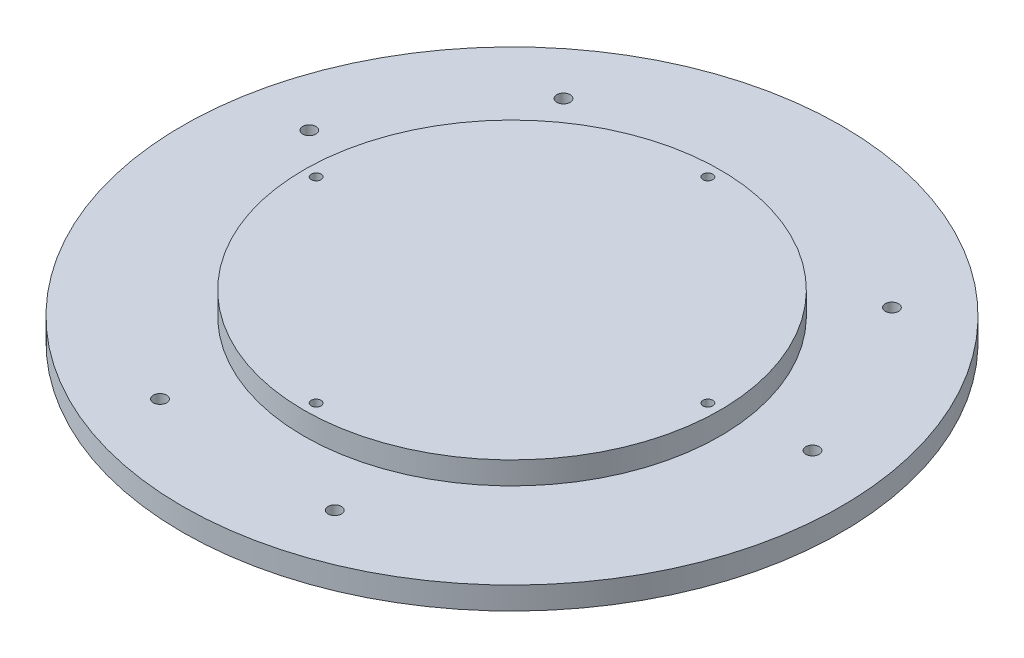
from build123d import *

# Parameters (mm, degrees)
ESQUISSE1_R                                = 84.1225
BOSS_EXTRU_1_DEPTH                         = 5.75
ESQUISSE2_R                                = 53.13
BOSS_EXTRU_2_DEPTH                         = 5.75
TROU_TARAUD_M31_D                          = 2.5
TROU_TARAUD_M31_DEPTH                      = 12.5
TROU_TARAUD_M31_TIP                        = 0.751075774
CHAMBRAGE_POUR_VIS_T_TE_HEXAGONALE_2_COUNT = 2
CHAMBRAGE_POUR_VIS_T_TE_HEXAGONALE_2_PITCH = 46.9428037
CHAMBRAGE_POUR_VIS_T_TE_HEXAGONALE_3_COUNT = 2
CHAMBRAGE_POUR_VIS_T_TE_HEXAGONALE_3_PITCH = 118.863351538
CHAMBRAGE_POUR_VIS_T_TE_HEXAGONALE_4_COUNT = 2
CHAMBRAGE_POUR_VIS_T_TE_HEXAGONALE_4_PITCH = 135.166416173
CHAMBRAGE_POUR_VIS_T_TE_HEXAGONALE_5_COUNT = 2
CHAMBRAGE_POUR_VIS_T_TE_HEXAGONALE_5_PITCH = 118.863351538
CHAMBRAGE_POUR_VIS_T_TE_HEXAGONALE_6_COUNT = 2
CHAMBRAGE_POUR_VIS_T_TE_HEXAGONALE_6_PITCH = 88.223612472


with BuildPart() as part:
    # Esquisse1 → Boss.-Extru.1 (new body)
    with BuildSketch(Plane(origin=(0, 0, 0), x_dir=(1, 0, 0), z_dir=(0, 1, 0))):
        Circle(ESQUISSE1_R)
    extrude(amount=-BOSS_EXTRU_1_DEPTH)

    # Esquisse2 → Boss.-Extru.2 (add)
    with BuildSketch(Plane(origin=(0, 0, 0), x_dir=(1, 0, 0), z_dir=(0, 1, 0))):
        Circle(ESQUISSE2_R)
    extrude(amount=BOSS_EXTRU_2_DEPTH)

    # Trou taraudé M31
    with Locations(Plane(origin=(0, -5.75, -50), x_dir=(0, 0, -1), z_dir=(0, -1, 0))):
        with Locations((0, 0), (-50, -50), (-100, 0), (-50, 50)):
            Hole(TROU_TARAUD_M31_D / 2, depth=TROU_TARAUD_M31_DEPTH)
            with Locations((0, 0, -(TROU_TARAUD_M31_DEPTH + TROU_TARAUD_M31_TIP / 2))):  # 118° drill point
                Cone(0, TROU_TARAUD_M31_D / 2, TROU_TARAUD_M31_TIP, mode=Mode.SUBTRACT)

    # Esquisse7 → Chambrage pour vis à tête hexagonale M31 (revolve, cut)
    with BuildSketch(Plane(origin=(-26.582568127, -5.75, 63.268205691), x_dir=(0, 0, -1), z_dir=(1, 0, 0))):
        Polygon((0, 0), (0, 11.5), (1.7, 11.5), (1.7, 2), (4.6755, 2), (4.6755, 0.025), (4.7005, 0), align=None)
    chambrage_pour_vis_t_te_hexagonale_m31 = revolve(axis=Axis((-26.582568127, -12.1, 63.268205691), (0, 1, 0)), mode=Mode.SUBTRACT)

    # Chambrage pour vis _ t_te hexagonale 2: Chambrage pour vis à tête hexagonale M31 ×2
    with Locations(*[Vector(0.998814611381004, 0, 0.04867619635729634) * (i * CHAMBRAGE_POUR_VIS_T_TE_HEXAGONALE_2_PITCH) for i in range(1, CHAMBRAGE_POUR_VIS_T_TE_HEXAGONALE_2_COUNT)]):
        add(chambrage_pour_vis_t_te_hexagonale_m31, mode=Mode.SUBTRACT)

    # Chambrage pour vis _ t_te hexagonale 3: Chambrage pour vis à tête hexagonale M31 ×2
    with Locations(*[Vector(0.796424838659598, 0, -0.6047375268379112) * (i * CHAMBRAGE_POUR_VIS_T_TE_HEXAGONALE_3_PITCH) for i in range(1, CHAMBRAGE_POUR_VIS_T_TE_HEXAGONALE_3_COUNT)]):
        add(chambrage_pour_vis_t_te_hexagonale_m31, mode=Mode.SUBTRACT)

    # Chambrage pour vis _ t_te hexagonale 4: Chambrage pour vis à tête hexagonale M31 ×2
    with Locations(*[Vector(0.5415621282955185, 0, -0.8406607289483841) * (i * CHAMBRAGE_POUR_VIS_T_TE_HEXAGONALE_4_PITCH) for i in range(1, CHAMBRAGE_POUR_VIS_T_TE_HEXAGONALE_4_COUNT)]):
        add(chambrage_pour_vis_t_te_hexagonale_m31, mode=Mode.SUBTRACT)

    # Chambrage pour vis _ t_te hexagonale 5: Chambrage pour vis à tête hexagonale M31 ×2
    with Locations(*[Vector(-0.12550564153360574, 0, -0.9920929059030904) * (i * CHAMBRAGE_POUR_VIS_T_TE_HEXAGONALE_5_PITCH) for i in range(1, CHAMBRAGE_POUR_VIS_T_TE_HEXAGONALE_5_COUNT)]):
        add(chambrage_pour_vis_t_te_hexagonale_m31, mode=Mode.SUBTRACT)

    # Chambrage pour vis _ t_te hexagonale 6: Chambrage pour vis à tête hexagonale M31 ×2
    with Locations(*[Vector(-0.4572524830854863, 0, -0.889336925305678) * (i * CHAMBRAGE_POUR_VIS_T_TE_HEXAGONALE_6_PITCH) for i in range(1, CHAMBRAGE_POUR_VIS_T_TE_HEXAGONALE_6_COUNT)]):
        add(chambrage_pour_vis_t_te_hexagonale_m31, mode=Mode.SUBTRACT)


solid = part.part
